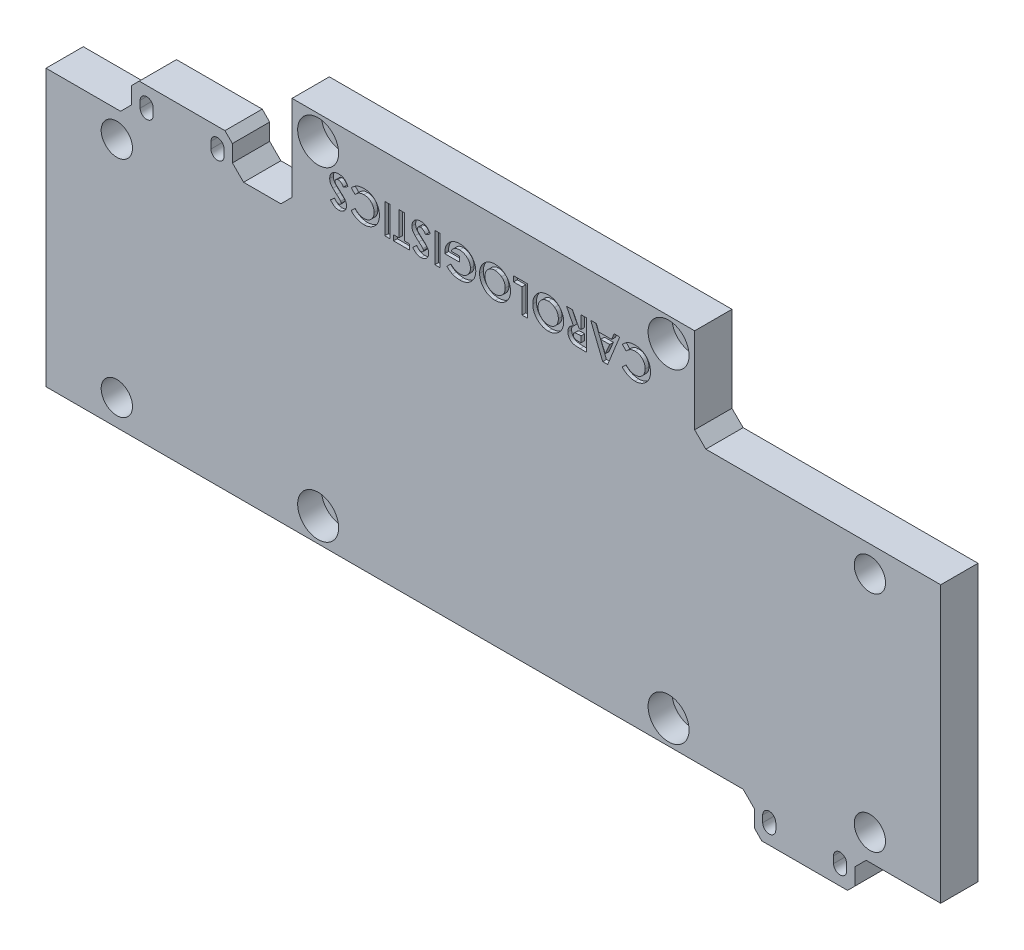
from build123d import *

# Parameters (mm, degrees)
SKIZZE1_W                                            = 240
SKIZZE1_H                                            = 100
AUFSATZ_LINEAR_AUSTRAGEN1_DEPTH                      = 10
STIRNSENKUNG_F_R_M6_ZYLINDERSCHRAUBE_MIT_D           = 6.6
STIRNSENKUNG_F_R_M6_ZYLINDERSCHRAUBE_MIT_DEPTH       = 15
STIRNSENKUNG_F_R_M6_ZYLINDERSCHRAUBE_MIT_CBORE_D     = 11
STIRNSENKUNG_F_R_M6_ZYLINDERSCHRAUBE_MIT_CBORE_DEPTH = 6.4
STIRNSENKUNG_F_R_M6_ZYLINDERSCHRAUBE_MIT_TIP         = 1.982840043
CBORE_FOR_M6_HEX_SOCKET_HEAD_CAP_SCREW1_D            = 6.6
CBORE_FOR_M6_HEX_SOCKET_HEAD_CAP_SCREW1_DEPTH        = 15
CBORE_FOR_M6_HEX_SOCKET_HEAD_CAP_SCREW1_CBORE_D      = 11
CBORE_FOR_M6_HEX_SOCKET_HEAD_CAP_SCREW1_CBORE_DEPTH  = 6.4
CBORE_FOR_M6_HEX_SOCKET_HEAD_CAP_SCREW1_TIP          = 1.982840043
M8_CLEARANCE_HOLE1_D                                 = 8.4
M8_CLEARANCE_HOLE1_DEPTH                             = 17
M8_CLEARANCE_HOLE1_TIP                               = 2.5236146
SKIZZE18_W                                           = 66
SKIZZE18_H                                           = 26
SCHNITT_LINEAR_AUSTRAGEN1_DEPTH                      = 15
SKETCH1_W                                            = 27
SKETCH1_H                                            = 10
BOSS_EXTRUDE1_DEPTH                                  = 9.5
CUT_EXTRUDE1_DEPTH                                   = 10
LPATTERN1_COUNT                                      = 2
LPATTERN1_PITCH                                      = 19
CUT_EXTRUDE2_START                                   = -10
CUT_EXTRUDE2_DEPTH                                   = 3
LPATTERN2_COUNT                                      = 2
LPATTERN2_PITCH                                      = 19
MIRROR1_COPY_1_DEPTH                                 = 10
MIRROR1_START                                        = -10
MIRROR1_COPY_2_DEPTH                                 = 3
SKETCH5_W                                            = 27
SKETCH5_H                                            = 9.5
CUT_EXTRUDE3_DEPTH                                   = 10
MIRROR2_COPY_1_DEPTH                                 = 10
MIRROR2_START                                        = -10
MIRROR2_COPY_2_DEPTH                                 = 3
CHAMFER1_SIZE                                        = 3
CHAMFER3_SIZE                                        = 2
CHAMFER4_SIZE                                        = 3
SKETCH8_W                                            = 1.435897436
SKETCH8_H                                            = 8
CUT_EXTRUDE4_DEPTH                                   = 1


with BuildPart() as part:
    # Skizze1 → Aufsatz-Linear austragen1 (new body)
    with BuildSketch(Plane.XY):
        Rectangle(SKIZZE1_W, SKIZZE1_H)
    extrude(amount=AUFSATZ_LINEAR_AUSTRAGEN1_DEPTH)

    # Stirnsenkung für M6 Zylinderschraube mit Innensechskant1
    with Locations(Plane.XY.offset(10)):
        with Locations((-47, -43.5), (47, -43.5)):
            CounterBoreHole(STIRNSENKUNG_F_R_M6_ZYLINDERSCHRAUBE_MIT_D / 2, STIRNSENKUNG_F_R_M6_ZYLINDERSCHRAUBE_MIT_CBORE_D / 2, STIRNSENKUNG_F_R_M6_ZYLINDERSCHRAUBE_MIT_CBORE_DEPTH, depth=STIRNSENKUNG_F_R_M6_ZYLINDERSCHRAUBE_MIT_DEPTH)
            with Locations((0, 0, -(STIRNSENKUNG_F_R_M6_ZYLINDERSCHRAUBE_MIT_DEPTH + STIRNSENKUNG_F_R_M6_ZYLINDERSCHRAUBE_MIT_TIP / 2))):  # 118° drill point
                Cone(0, STIRNSENKUNG_F_R_M6_ZYLINDERSCHRAUBE_MIT_D / 2, STIRNSENKUNG_F_R_M6_ZYLINDERSCHRAUBE_MIT_TIP, mode=Mode.SUBTRACT)

    # CBORE for M6 Hex Socket Head Cap Screw1
    with Locations(Plane.XY.offset(10)):
        with Locations((-47, 43.5), (47, 43.5)):
            CounterBoreHole(CBORE_FOR_M6_HEX_SOCKET_HEAD_CAP_SCREW1_D / 2, CBORE_FOR_M6_HEX_SOCKET_HEAD_CAP_SCREW1_CBORE_D / 2, CBORE_FOR_M6_HEX_SOCKET_HEAD_CAP_SCREW1_CBORE_DEPTH, depth=CBORE_FOR_M6_HEX_SOCKET_HEAD_CAP_SCREW1_DEPTH)
            with Locations((0, 0, -(CBORE_FOR_M6_HEX_SOCKET_HEAD_CAP_SCREW1_DEPTH + CBORE_FOR_M6_HEX_SOCKET_HEAD_CAP_SCREW1_TIP / 2))):  # 118° drill point
                Cone(0, CBORE_FOR_M6_HEX_SOCKET_HEAD_CAP_SCREW1_D / 2, CBORE_FOR_M6_HEX_SOCKET_HEAD_CAP_SCREW1_TIP, mode=Mode.SUBTRACT)

    # M8 Clearance Hole1
    with Locations(Plane.XY.offset(10)):
        with Locations((-101, 17), (-101, -43), (101, 17), (101, -43)):
            Hole(M8_CLEARANCE_HOLE1_D / 2, depth=M8_CLEARANCE_HOLE1_DEPTH)
            with Locations((0, 0, -(M8_CLEARANCE_HOLE1_DEPTH + M8_CLEARANCE_HOLE1_TIP / 2))):  # 118° drill point
                Cone(0, M8_CLEARANCE_HOLE1_D / 2, M8_CLEARANCE_HOLE1_TIP, mode=Mode.SUBTRACT)

    # Skizze18 → Schnitt-Linear austragen1 (cut)
    with BuildSketch(Plane.XY.offset(10)):
        with Locations((-87, 37)):
            Rectangle(SKIZZE18_W, SKIZZE18_H)
    schnitt_linear_austragen1 = extrude(amount=-SCHNITT_LINEAR_AUSTRAGEN1_DEPTH, mode=Mode.SUBTRACT)

    # Spiegeln1: Schnitt-Linear austragen1 across plane
    add(schnitt_linear_austragen1.mirror(Plane(origin=(0, 0, 0), x_dir=(0, 0, 1), z_dir=(1, 0, 0))), mode=Mode.SUBTRACT)

    # Sketch1 → Boss-Extrude1 (add)
    with BuildSketch(Plane(origin=(0, 24, 0), x_dir=(1, 0, 0), z_dir=(0, 1, 0))):
        with Locations((83.5, -5)):
            Rectangle(SKETCH1_W, SKETCH1_H)
    boss_extrude1 = extrude(amount=BOSS_EXTRUDE1_DEPTH)

    # Sketch3 → Cut-Extrude1 (cut)
    with BuildSketch(Plane(origin=(0, 0, 0), x_dir=(-1, 0, 0), z_dir=(0, 0, -1))):
        with BuildLine():
            Line((-91.25, 29.15), (-91.25, 27.35))
            ThreePointArc((-91.25, 27.35), (-93, 25.6), (-94.75, 27.35))
            Line((-94.75, 27.35), (-94.75, 29.15))
            ThreePointArc((-94.75, 29.15), (-93, 30.9), (-91.25, 29.15))
        make_face()
    cut_extrude1 = extrude(amount=-CUT_EXTRUDE1_DEPTH, mode=Mode.SUBTRACT)

    # LPattern1: Cut-Extrude1 ×2
    with Locations(*[(-i * LPATTERN1_PITCH, 0, 0) for i in range(1, LPATTERN1_COUNT)]):
        add(cut_extrude1, mode=Mode.SUBTRACT)

    # Sketch4 → Cut-Extrude2 (cut)
    with BuildSketch(Plane.XY.offset(10).offset(CUT_EXTRUDE2_START)):
        Polygon((74, 32.383161507), (71.2, 30.766580754), (71.2, 28.375279034), (71.2, 25.733419246), (74, 24.116838493), (76.8, 25.733419246), (76.8, 28.372780006), (76.8, 30.766580754), align=None)
    cut_extrude2 = extrude(amount=CUT_EXTRUDE2_DEPTH, mode=Mode.SUBTRACT)

    # LPattern2: Cut-Extrude2 ×2
    with Locations(*[(i * LPATTERN2_PITCH, 0, 0) for i in range(1, LPATTERN2_COUNT)]):
        add(cut_extrude2, mode=Mode.SUBTRACT)

    # Mirror1: Boss-Extrude1, Cut-Extrude1, Cut-Extrude2 across plane
    add(boss_extrude1.mirror(Plane.ZX.offset(-13)))
    add(cut_extrude1.mirror(Plane.ZX.offset(-13)), mode=Mode.SUBTRACT)
    add(cut_extrude2.mirror(Plane.ZX.offset(-13)), mode=Mode.SUBTRACT)

    # Mirror1 copy 1 sketch → Mirror1 copy 1 (cut)
    with BuildSketch(Plane(origin=(-19, -26, 0), x_dir=(-1, 0, 0), z_dir=(0, 0, -1))):
        with BuildLine():
            Line((-91.25, -29.15), (-91.25, -27.35))
            ThreePointArc((-91.25, -27.35), (-93, -25.6), (-94.75, -27.35))
            Line((-94.75, -27.35), (-94.75, -29.15))
            ThreePointArc((-94.75, -29.15), (-93, -30.9), (-91.25, -29.15))
        make_face()
    extrude(amount=-MIRROR1_COPY_1_DEPTH, mode=Mode.SUBTRACT)

    # Mirror1 copy 2 sketch → Mirror1 copy 2 (cut)
    with BuildSketch(Plane(origin=(19, -26, 10), x_dir=(1, 0, 0), z_dir=(0, 0, 1)).offset(MIRROR1_START)):
        Polygon((74, -32.383161507), (71.2, -30.766580754), (71.2, -28.375279034), (71.2, -25.733419246), (74, -24.116838493), (76.8, -25.733419246), (76.8, -28.372780006), (76.8, -30.766580754), align=None)
    extrude(amount=MIRROR1_COPY_2_DEPTH, mode=Mode.SUBTRACT)

    # Sketch5 → Cut-Extrude3 (cut)
    with BuildSketch(Plane.XY.offset(10)):
        with Locations((83.5, 28.75)):
            Rectangle(SKETCH5_W, SKETCH5_H)
    extrude(amount=-CUT_EXTRUDE3_DEPTH, mode=Mode.SUBTRACT)

    # Mirror2: Boss-Extrude1, Cut-Extrude1, Cut-Extrude2 across plane
    add(boss_extrude1.mirror(Plane(origin=(0, 0, 0), x_dir=(0, 0, 1), z_dir=(1, 0, 0))))
    add(cut_extrude1.mirror(Plane(origin=(0, 0, 0), x_dir=(0, 0, 1), z_dir=(1, 0, 0))), mode=Mode.SUBTRACT)
    add(cut_extrude2.mirror(Plane(origin=(0, 0, 0), x_dir=(0, 0, 1), z_dir=(1, 0, 0))), mode=Mode.SUBTRACT)

    # Mirror2 copy 1 sketch → Mirror2 copy 1 (cut)
    with BuildSketch(Plane(origin=(19, 0, 0), x_dir=(1, 0, 0), z_dir=(0, 0, -1))):
        with BuildLine():
            Line((-91.25, -29.15), (-91.25, -27.35))
            ThreePointArc((-91.25, -27.35), (-93, -25.6), (-94.75, -27.35))
            Line((-94.75, -27.35), (-94.75, -29.15))
            ThreePointArc((-94.75, -29.15), (-93, -30.9), (-91.25, -29.15))
        make_face()
    extrude(amount=-MIRROR2_COPY_1_DEPTH, mode=Mode.SUBTRACT)

    # Mirror2 copy 2 sketch → Mirror2 copy 2 (cut)
    with BuildSketch(Plane(origin=(-19, 0, 10), x_dir=(-1, 0, 0), z_dir=(0, 0, 1)).offset(MIRROR2_START)):
        Polygon((74, -32.383161507), (71.2, -30.766580754), (71.2, -28.375279034), (71.2, -25.733419246), (74, -24.116838493), (76.8, -25.733419246), (76.8, -28.372780006), (76.8, -30.766580754), align=None)
    extrude(amount=MIRROR2_COPY_2_DEPTH, mode=Mode.SUBTRACT)

    # Chamfer1
    chamfer1_edges = [part.edges().sort_by_distance(p)[0] for p in [
        (-70, 24, 5),
        (-97, 24, 5),
        (97, -50, 5),
        (70, -50, 5),
    ]]
    chamfer(chamfer1_edges, length=CHAMFER1_SIZE)

    # Chamfer3
    chamfer3_edges = [part.edges().sort_by_distance(p)[0] for p in [
        (-97, 33.5, 5),
        (-70, 33.5, 5),
        (70, -59.5, 5),
        (97, -59.5, 5),
    ]]
    chamfer(chamfer3_edges, length=CHAMFER3_SIZE)

    # Chamfer4
    chamfer4_edges = [part.edges().sort_by_distance(p)[0] for p in [
        (-54, 24, 5),
        (54, 24, 5),
    ]]
    chamfer(chamfer4_edges, length=CHAMFER4_SIZE)

    # Sketch8 → Cut-Extrude4 (cut)
    # profile 1 of 13: a face of its own
    with BuildSketch(Plane.XY.offset(10)):
        with BuildLine():
            Line((-43.692307692, 31.568910256), (-42.618589744, 32.551282051))
            add(Edge.make_bspline(
                [(-42.618589744, 32.551282051), (-42.572605121, 32.486391886), (-42.484321058, 32.361811817), (-42.341077959, 32.195178274), (-42.198690635, 32.052094928), (-42.054247834, 31.936652697), (-41.910236405, 31.843718064), (-41.763596751, 31.7796173), (-41.616015858, 31.738393715), (-41.516812206, 31.733285379), (-41.467948718, 31.730769231)],
                knots=[0, 0, 0, 0, 1.299459705, 2.494781419, 3.587730629, 4.594196874, 5.512431013, 6.380462003, 7.202284646, 8, 8, 8, 8], degree=3))
            add(Edge.make_bspline(
                [(-41.467948718, 31.730769231), (-41.422351589, 31.732320008), (-41.334315512, 31.735314152), (-41.209398131, 31.766573359), (-41.097138761, 31.817086557), (-41.000527688, 31.88686248), (-40.922806182, 31.970195179), (-40.862373068, 32.058906905), (-40.827255268, 32.155631897), (-40.822745449, 32.22196759), (-40.820512821, 32.254807692)],
                knots=[0, 0, 0, 0, 1.184157716, 2.286297433, 3.324836695, 4.370048774, 5.362957217, 6.276446515, 7.146738784, 8, 8, 8, 8], degree=3))
            add(Edge.make_bspline(
                [(-40.820512821, 32.254807692), (-40.821926071, 32.28810595), (-40.824772161, 32.355164012), (-40.852261519, 32.453445954), (-40.89369583, 32.549478853), (-40.933288005, 32.607938648), (-40.953525641, 32.637820513)],
                knots=[0, 0, 0, 0, 0.967525499, 1.948461899, 2.951351359, 4, 4, 4, 4], degree=3))
            add(Edge.make_bspline(
                [(-40.953525641, 32.637820513), (-40.971998034, 32.660978274), (-41.014764735, 32.714592392), (-41.09383378, 32.800864935), (-41.197221313, 32.902144102), (-41.320557563, 33.023533065), (-41.468471106, 33.160316642), (-41.637786171, 33.316455249), (-41.832269823, 33.486644971), (-41.968525472, 33.606791155), (-42.040064103, 33.669871795)],
                knots=[0, 0, 0, 0, 0.473849886, 1.097042329, 1.870584189, 2.789244661, 3.865562256, 5.093556389, 6.47402294, 8, 8, 8, 8], degree=3))
            add(Edge.make_bspline(
                [(-42.040064103, 33.669871795), (-42.1073743, 33.728095599), (-42.235115072, 33.838592282), (-42.416634474, 33.995682489), (-42.57719845, 34.136378406), (-42.715346732, 34.261733606), (-42.835207519, 34.366585802), (-42.931479644, 34.457385645), (-43.008283353, 34.530161036), (-43.05189886, 34.574167786), (-43.070512821, 34.592948718)],
                knots=[0, 0, 0, 0, 1.543627419, 2.929484142, 4.163674036, 5.24627963, 6.164986907, 6.925413438, 7.541394495, 8, 8, 8, 8], degree=3))
            add(Edge.make_bspline(
                [(-43.070512821, 34.592948718), (-43.141173849, 34.669359058), (-43.277009161, 34.816246566), (-43.453201125, 35.044492222), (-43.599775805, 35.265583992), (-43.713282888, 35.485765141), (-43.795603245, 35.709585924), (-43.855529547, 35.940239708), (-43.89144958, 36.181024385), (-43.895425109, 36.344964897), (-43.897435897, 36.427884615)],
                knots=[0, 0, 0, 0, 1.206413378, 2.319150186, 3.339784753, 4.27899982, 5.184598145, 6.099639703, 7.038813909, 8, 8, 8, 8], degree=3))
            add(Edge.make_bspline(
                [(-43.897435897, 36.427884615), (-43.896002909, 36.508680375), (-43.893191333, 36.667204664), (-43.858792209, 36.899192111), (-43.809670962, 37.121172988), (-43.733980911, 37.330923494), (-43.640951878, 37.530929344), (-43.527571921, 37.721257796), (-43.388953593, 37.89746544), (-43.234989034, 38.064306845), (-43.062026093, 38.214064396), (-42.876035237, 38.346095), (-42.676662269, 38.457571747), (-42.465426554, 38.549440075), (-42.239678856, 38.617616516), (-42.002985444, 38.669161877), (-41.752961539, 38.700241294), (-41.582353378, 38.703475764), (-41.495192308, 38.705128205)],
                knots=[0, 0, 0, 0, 1.043039441, 2.046482205, 3.024244422, 3.976033659, 4.920890471, 5.871402525, 6.830893638, 7.812473116, 8.800703348, 9.781190227, 10.754606487, 11.746997808, 12.751247331, 13.796362838, 14.874195872, 16, 16, 16, 16], degree=3))
            add(Edge.make_bspline(
                [(-41.495192308, 38.705128205), (-41.426770605, 38.703915682), (-41.291256394, 38.701514191), (-41.091538367, 38.681867741), (-40.898651894, 38.650260397), (-40.712982228, 38.60460865), (-40.533354896, 38.548084075), (-40.36171925, 38.474581929), (-40.19579329, 38.39146072), (-40.036128814, 38.295136699), (-39.884048879, 38.183265699), (-39.735171781, 38.060263197), (-39.594775362, 37.919383034), (-39.457495455, 37.765761046), (-39.329065548, 37.594944901), (-39.202718077, 37.412074613), (-39.084619698, 37.212778557), (-39.011636945, 37.072998907), (-38.974358974, 37.001602564)],
                knots=[0, 0, 0, 0, 1.017088714, 2.014418954, 2.980620591, 3.920647918, 4.854987948, 5.776890852, 6.693269322, 7.612671471, 8.545186947, 9.498010697, 10.480815007, 11.499174288, 12.558697099, 13.655746277, 14.802607237, 16, 16, 16, 16], degree=3))
            Line((-38.974358974, 37.001602564), (-40.237179487, 36.243589744))
            add(Edge.make_bspline(
                [(-40.237179487, 36.243589744), (-40.28380534, 36.324636632), (-40.373191085, 36.480010445), (-40.524663586, 36.688774854), (-40.679839431, 36.867547013), (-40.842306145, 37.013167114), (-41.010088195, 37.127582284), (-41.183996006, 37.209351302), (-41.364151764, 37.259966231), (-41.486865681, 37.266147483), (-41.548076923, 37.269230769)],
                knots=[0, 0, 0, 0, 1.283663364, 2.460892379, 3.537111102, 4.529833553, 5.449777664, 6.316464042, 7.160231139, 8, 8, 8, 8], degree=3))
            add(Edge.make_bspline(
                [(-41.548076923, 37.269230769), (-41.610348985, 37.266736718), (-41.731165855, 37.261897894), (-41.903900373, 37.216321083), (-42.062963993, 37.14636669), (-42.199718313, 37.044628781), (-42.315849019, 36.928617973), (-42.399102801, 36.797776049), (-42.45310662, 36.657907654), (-42.458716841, 36.560305992), (-42.461538462, 36.511217949)],
                knots=[0, 0, 0, 0, 1.13537643, 2.202795631, 3.242191317, 4.290390765, 5.297919085, 6.223733717, 7.106639842, 8, 8, 8, 8], degree=3))
            add(Edge.make_bspline(
                [(-42.461538462, 36.511217949), (-42.458897344, 36.465572433), (-42.453532168, 36.372847939), (-42.414229005, 36.234901488), (-42.352270582, 36.097623934), (-42.281166013, 35.983833463), (-42.207035671, 35.888984373), (-42.134373734, 35.808037659), (-42.048256772, 35.716734566), (-41.946490476, 35.617564832), (-41.831054185, 35.508621737), (-41.701569983, 35.390164305), (-41.556643447, 35.263158136), (-41.454204968, 35.176646323), (-41.400641026, 35.131410256)],
                knots=[0, 0, 0, 0, 0.916057066, 1.860882232, 2.859899639, 3.934694552, 4.546382938, 5.276161949, 6.118633209, 7.067046139, 8.129668089, 9.306861125, 10.591787583, 12, 12, 12, 12], degree=3))
            add(Edge.make_bspline(
                [(-41.400641026, 35.131410256), (-41.298817651, 35.045252262), (-41.103387776, 34.879888993), (-40.827171255, 34.635701008), (-40.578448717, 34.407315006), (-40.358878954, 34.192903875), (-40.167809734, 33.993837571), (-40.003137653, 33.8118637), (-39.867523727, 33.643413784), (-39.726900406, 33.442220303), (-39.589507299, 33.200510133), (-39.472742713, 32.90833872), (-39.397279698, 32.616533122), (-39.388792648, 32.420301645), (-39.384615385, 32.323717949)],
                knots=[0, 0, 0, 0, 1.345685333, 2.582777463, 3.719355561, 4.752181389, 5.678433858, 6.502864483, 7.227563063, 7.858499643, 8.978226409, 10.023061349, 11.026965269, 12, 12, 12, 12], degree=3))
            add(Edge.make_bspline(
                [(-39.384615385, 32.323717949), (-39.386353518, 32.255227588), (-39.389777827, 32.12029422), (-39.420232751, 31.921871098), (-39.465960473, 31.730499948), (-39.531674037, 31.546229193), (-39.619813924, 31.371134735), (-39.723923277, 31.202382632), (-39.846966576, 31.040488673), (-39.987987266, 30.889044141), (-40.142789168, 30.749828531), (-40.307900449, 30.627688876), (-40.481795622, 30.52440797), (-40.66500202, 30.440269435), (-40.857195458, 30.374612005), (-41.058553453, 30.328210837), (-41.268458944, 30.300539994), (-41.411240877, 30.296784734), (-41.483974359, 30.294871795)],
                knots=[0, 0, 0, 0, 1.010806554, 1.991397492, 2.957573065, 3.913225829, 4.872777376, 5.846906201, 6.837692339, 7.870332167, 8.898170327, 9.907899016, 10.8981826, 11.879407896, 12.8797257, 13.891947133, 14.926152479, 16, 16, 16, 16], degree=3))
            add(Edge.make_bspline(
                [(-41.483974359, 30.294871795), (-41.578227768, 30.298329175), (-41.765990583, 30.305216645), (-42.043685486, 30.358793505), (-42.315059803, 30.443937665), (-42.534415514, 30.54423366), (-42.707451186, 30.644487857), (-42.840389245, 30.734916546), (-42.976715801, 30.838759708), (-43.113928134, 30.959039257), (-43.257229372, 31.088802282), (-43.399381267, 31.23695395), (-43.547344811, 31.395903393), (-43.643140224, 31.510231032), (-43.692307692, 31.568910256)],
                knots=[0, 0, 0, 0, 1.282890948, 2.555655204, 3.837225328, 5.149160694, 5.83044799, 6.558852598, 7.337307105, 8.162686284, 9.043076448, 9.969084596, 10.957622644, 12, 12, 12, 12], degree=3))
        make_face()
    # profile 2 of 13: a face of its own
    with BuildSketch(Plane.XY.offset(10)):
        with BuildLine():
            Line((-38.153846154, 31.887820513), (-37.100961538, 32.894230769))
            add(Edge.make_bspline(
                [(-37.100961538, 32.894230769), (-37.011751247, 32.801745077), (-36.837211934, 32.620797467), (-36.554626072, 32.383917342), (-36.264116209, 32.182598967), (-35.964869214, 32.018510179), (-35.657056991, 31.888287999), (-35.340144003, 31.797445062), (-35.014895762, 31.74024497), (-34.795107561, 31.733945363), (-34.684294872, 31.730769231)],
                knots=[0, 0, 0, 0, 1.115370381, 2.182214363, 3.196266025, 4.180416361, 5.141116029, 6.092551847, 7.038303877, 8, 8, 8, 8], degree=3))
            add(Edge.make_bspline(
                [(-34.684294872, 31.730769231), (-34.591765108, 31.733327683), (-34.409167815, 31.738376508), (-34.141092473, 31.775478563), (-33.884567328, 31.838334239), (-33.639388859, 31.925703172), (-33.404344878, 32.035729955), (-33.181624061, 32.174025688), (-32.970029484, 32.335974584), (-32.772033453, 32.521293253), (-32.593285866, 32.72526574), (-32.432231751, 32.940085334), (-32.298831746, 33.169551672), (-32.189937473, 33.410318432), (-32.104126283, 33.662472556), (-32.043222637, 33.926001422), (-32.007935024, 34.201500032), (-32.002673872, 34.388788732), (-32, 34.483974359)],
                knots=[0, 0, 0, 0, 1.035268443, 2.04298821, 3.02163646, 3.985902049, 4.951223231, 5.920091634, 6.913651787, 7.92868536, 8.949353712, 9.945284791, 10.92850487, 11.913014323, 12.897904816, 13.904240668, 14.934873455, 16, 16, 16, 16], degree=3))
            add(Edge.make_bspline(
                [(-32, 34.483974359), (-32.00078158, 34.550780332), (-32.00232209, 34.682456277), (-32.01876024, 34.876741091), (-32.046060031, 35.065650917), (-32.084350147, 35.248626038), (-32.132554145, 35.426455768), (-32.191551249, 35.597981809), (-32.262884416, 35.763424231), (-32.342718078, 35.923649669), (-32.431829499, 36.07730046), (-32.531719314, 36.222339036), (-32.641268186, 36.357638388), (-32.756092672, 36.487906461), (-32.883797343, 36.605519772), (-33.018664414, 36.716960157), (-33.162628967, 36.819466841), (-33.315516171, 36.911613302), (-33.472762517, 36.997492204), (-33.637590228, 37.068610998), (-33.805393369, 37.132542559), (-33.979115773, 37.180638328), (-34.155697329, 37.22247148), (-34.337595887, 37.248020288), (-34.523085162, 37.267434003), (-34.648450297, 37.268629269), (-34.711538462, 37.269230769)],
                knots=[0, 0, 0, 0, 1.103833241, 2.175677997, 3.219414644, 4.256521947, 5.263082927, 6.262573145, 7.25136242, 8.238376666, 9.219530388, 10.184343756, 11.145312504, 12.095474572, 13.051075647, 14.010745898, 14.985684176, 15.968306307, 16.959653902, 17.943861036, 18.93268972, 19.924626761, 20.920484516, 21.929288403, 22.957944781, 24, 24, 24, 24], degree=3))
            add(Edge.make_bspline(
                [(-34.711538462, 37.269230769), (-34.818548697, 37.266142538), (-35.028795984, 37.260074966), (-35.33731864, 37.212420272), (-35.632156384, 37.134383783), (-35.867268317, 37.040521186), (-36.051232232, 36.949273334), (-36.191209319, 36.866079872), (-36.335345138, 36.771845125), (-36.482652838, 36.663958642), (-36.633929808, 36.543704323), (-36.786577235, 36.408568702), (-36.944481947, 36.262966943), (-37.047924584, 36.159049584), (-37.100961538, 36.105769231)],
                knots=[0, 0, 0, 0, 1.404640003, 2.759752344, 4.088613405, 5.401587939, 6.076032573, 6.783413463, 7.538272532, 8.336594406, 9.180107851, 10.074881764, 11.012956238, 12, 12, 12, 12], degree=3))
            Line((-37.100961538, 36.105769231), (-38.121794872, 37.177884615))
            add(Edge.make_bspline(
                [(-38.121794872, 37.177884615), (-38.050035784, 37.247165765), (-37.909977391, 37.382387754), (-37.698703178, 37.574390314), (-37.487694918, 37.746926128), (-37.282049881, 37.906256701), (-37.078400262, 38.04774306), (-36.876764627, 38.171517046), (-36.679436127, 38.280742219), (-36.482280087, 38.373461505), (-36.283731468, 38.45269227), (-36.079531904, 38.519511581), (-35.869583826, 38.57784026), (-35.652148438, 38.623741922), (-35.428195913, 38.661109052), (-35.197006613, 38.685800429), (-34.959660731, 38.702922346), (-34.799176951, 38.704386918), (-34.717948718, 38.705128205)],
                knots=[0, 0, 0, 0, 1.244537013, 2.429070097, 3.56066612, 4.644477994, 5.67429546, 6.652817684, 7.595405349, 8.486886006, 9.369351459, 10.26090686, 11.166404474, 12.086719576, 13.0323422, 13.998023148, 14.9867073, 16, 16, 16, 16], degree=3))
            add(Edge.make_bspline(
                [(-34.717948718, 38.705128205), (-34.568748266, 38.701318066), (-34.276804455, 38.693862684), (-33.848927164, 38.638813508), (-33.442118002, 38.54591522), (-33.055645995, 38.416316299), (-32.690693908, 38.248032792), (-32.346117246, 38.04384009), (-32.022489835, 37.801800187), (-31.722596457, 37.525519253), (-31.451413622, 37.220325962), (-31.211448436, 36.892757665), (-31.013822268, 36.54046201), (-30.846146622, 36.170985398), (-30.720499196, 35.778551482), (-30.629038944, 35.366706355), (-30.573385858, 34.933682649), (-30.567238008, 34.637986461), (-30.564102564, 34.487179487)],
                knots=[0, 0, 0, 0, 1.07798487, 2.109316747, 3.111276023, 4.08905949, 5.049398091, 6.009992678, 6.978127636, 7.964347882, 8.951383687, 9.924270623, 10.892397886, 11.86520058, 12.851549246, 13.863953586, 14.910602472, 16, 16, 16, 16], degree=3))
            add(Edge.make_bspline(
                [(-30.564102564, 34.487179487), (-30.565471958, 34.38882865), (-30.568185761, 34.193921327), (-30.594939344, 33.906062494), (-30.635980507, 33.626616271), (-30.694391719, 33.355926354), (-30.767018309, 33.093055493), (-30.859461455, 32.839193885), (-30.966534357, 32.592951802), (-31.091540812, 32.356624013), (-31.231666377, 32.129911873), (-31.384861512, 31.913388437), (-31.55407626, 31.709207361), (-31.737702606, 31.516475619), (-31.93421444, 31.333947526), (-32.145533635, 31.162918499), (-32.371862253, 31.004491462), (-32.610891665, 30.858536212), (-32.858071276, 30.724496463), (-33.113576754, 30.612104467), (-33.372428792, 30.512889589), (-33.636381255, 30.432751567), (-33.906015108, 30.372303257), (-34.179271369, 30.326687019), (-34.458382724, 30.301156618), (-34.645785135, 30.296980082), (-34.740384615, 30.294871795)],
                knots=[0, 0, 0, 0, 1.07193642, 2.124315995, 3.14887099, 4.149444713, 5.141371803, 6.119544533, 7.092241254, 8.06650569, 9.031360777, 9.996057679, 10.955696533, 11.919602115, 12.89624813, 13.877605408, 14.880920851, 15.905674436, 16.929600311, 17.943674756, 18.946313929, 19.950355855, 20.947755382, 21.956851243, 22.968632213, 24, 24, 24, 24], degree=3))
            add(Edge.make_bspline(
                [(-34.740384615, 30.294871795), (-34.82108706, 30.296081836), (-34.981652869, 30.298489337), (-35.220768893, 30.318523009), (-35.457946403, 30.350075019), (-35.692461133, 30.397347624), (-35.925367684, 30.454596925), (-36.155690937, 30.525112609), (-36.382795769, 30.611125217), (-36.608650999, 30.706273312), (-36.828752282, 30.814594479), (-37.041186787, 30.935838799), (-37.246480891, 31.066834406), (-37.44339701, 31.209834445), (-37.633322109, 31.362738431), (-37.816053542, 31.525541303), (-37.989837862, 31.701196263), (-38.098900347, 31.825297942), (-38.153846154, 31.887820513)],
                knots=[0, 0, 0, 0, 0.996333415, 1.982307736, 2.96084097, 3.949129141, 4.93457382, 5.921430247, 6.92116383, 7.931890485, 8.946633814, 9.948019707, 10.950686436, 11.952094051, 12.951305284, 13.960287133, 14.972390273, 16, 16, 16, 16], degree=3))
        make_face()
    # profile 3 of 13: a face of its own
    with BuildSketch(Plane.XY.offset(10)):
        with Locations((-28.41025641, 34.5)):
            Rectangle(SKETCH8_W, SKETCH8_H)
    # profile 4 of 13: a face of its own
    with BuildSketch(Plane.XY.offset(10)):
        Polygon((-22.461538462, 30.5), (-26.769230769, 30.5), (-26.769230769, 31.935897436), (-25.333333333, 31.935897436), (-25.333333333, 38.5), (-23.897435897, 38.5), (-23.897435897, 31.935897436), (-22.461538462, 31.935897436), align=None)
    # profile 5 of 13: a face of its own
    with BuildSketch(Plane.XY.offset(10)):
        with BuildLine():
            Line((-21.641025641, 31.568910256), (-20.567307692, 32.551282051))
            add(Edge.make_bspline(
                [(-20.567307692, 32.551282051), (-20.52132307, 32.486391886), (-20.433039007, 32.361811817), (-20.289795907, 32.195178274), (-20.147408584, 32.052094928), (-20.002965782, 31.936652697), (-19.858954354, 31.843718064), (-19.7123147, 31.7796173), (-19.564733807, 31.738393715), (-19.465530155, 31.733285379), (-19.416666667, 31.730769231)],
                knots=[0, 0, 0, 0, 1.299459705, 2.494781419, 3.587730629, 4.594196874, 5.512431013, 6.380462003, 7.202284646, 8, 8, 8, 8], degree=3))
            add(Edge.make_bspline(
                [(-19.416666667, 31.730769231), (-19.371069537, 31.732320008), (-19.28303346, 31.735314152), (-19.15811608, 31.766573359), (-19.04585671, 31.817086557), (-18.949245637, 31.88686248), (-18.87152413, 31.970195179), (-18.811091017, 32.058906905), (-18.775973217, 32.155631897), (-18.771463397, 32.22196759), (-18.769230769, 32.254807692)],
                knots=[0, 0, 0, 0, 1.184157716, 2.286297433, 3.324836695, 4.370048774, 5.362957217, 6.276446515, 7.146738784, 8, 8, 8, 8], degree=3))
            add(Edge.make_bspline(
                [(-18.769230769, 32.254807692), (-18.77064402, 32.28810595), (-18.77349011, 32.355164012), (-18.800979467, 32.453445954), (-18.842413778, 32.549478853), (-18.882005954, 32.607938648), (-18.90224359, 32.637820513)],
                knots=[0, 0, 0, 0, 0.967525499, 1.948461899, 2.951351359, 4, 4, 4, 4], degree=3))
            add(Edge.make_bspline(
                [(-18.90224359, 32.637820513), (-18.920715982, 32.660978274), (-18.963482684, 32.714592392), (-19.042551729, 32.800864935), (-19.145939261, 32.902144102), (-19.269275512, 33.023533065), (-19.417189055, 33.160316642), (-19.586504119, 33.316455249), (-19.780987771, 33.486644971), (-19.917243421, 33.606791155), (-19.988782051, 33.669871795)],
                knots=[0, 0, 0, 0, 0.473849886, 1.097042329, 1.870584189, 2.789244661, 3.865562256, 5.093556389, 6.47402294, 8, 8, 8, 8], degree=3))
            add(Edge.make_bspline(
                [(-19.988782051, 33.669871795), (-20.056092249, 33.728095599), (-20.183833021, 33.838592282), (-20.365352423, 33.995682489), (-20.525916398, 34.136378406), (-20.664064681, 34.261733606), (-20.783925468, 34.366585802), (-20.880197593, 34.457385645), (-20.957001302, 34.530161036), (-21.000616809, 34.574167786), (-21.019230769, 34.592948718)],
                knots=[0, 0, 0, 0, 1.543627419, 2.929484142, 4.163674036, 5.24627963, 6.164986907, 6.925413438, 7.541394495, 8, 8, 8, 8], degree=3))
            add(Edge.make_bspline(
                [(-21.019230769, 34.592948718), (-21.089891798, 34.669359058), (-21.22572711, 34.816246566), (-21.401919074, 35.044492222), (-21.548493754, 35.265583992), (-21.662000837, 35.485765141), (-21.744321194, 35.709585924), (-21.804247496, 35.940239708), (-21.840167529, 36.181024385), (-21.844143057, 36.344964897), (-21.846153846, 36.427884615)],
                knots=[0, 0, 0, 0, 1.206413378, 2.319150186, 3.339784753, 4.27899982, 5.184598145, 6.099639703, 7.038813909, 8, 8, 8, 8], degree=3))
            add(Edge.make_bspline(
                [(-21.846153846, 36.427884615), (-21.844720858, 36.508680375), (-21.841909282, 36.667204664), (-21.807510158, 36.899192111), (-21.758388911, 37.121172988), (-21.68269886, 37.330923494), (-21.589669827, 37.530929344), (-21.47628987, 37.721257796), (-21.337671541, 37.89746544), (-21.183706983, 38.064306845), (-21.010744042, 38.214064396), (-20.824753186, 38.346095), (-20.625380218, 38.457571747), (-20.414144502, 38.549440075), (-20.188396805, 38.617616516), (-19.951703393, 38.669161877), (-19.701679488, 38.700241294), (-19.531071326, 38.703475764), (-19.443910256, 38.705128205)],
                knots=[0, 0, 0, 0, 1.043039441, 2.046482205, 3.024244422, 3.976033659, 4.920890471, 5.871402525, 6.830893638, 7.812473116, 8.800703348, 9.781190227, 10.754606487, 11.746997808, 12.751247331, 13.796362838, 14.874195872, 16, 16, 16, 16], degree=3))
            add(Edge.make_bspline(
                [(-19.443910256, 38.705128205), (-19.375488554, 38.703915682), (-19.239974342, 38.701514191), (-19.040256316, 38.681867741), (-18.847369843, 38.650260397), (-18.661700176, 38.60460865), (-18.482072845, 38.548084075), (-18.310437199, 38.474581929), (-18.144511239, 38.39146072), (-17.984846762, 38.295136699), (-17.832766828, 38.183265699), (-17.68388973, 38.060263197), (-17.54349331, 37.919383034), (-17.406213404, 37.765761046), (-17.277783497, 37.594944901), (-17.151436025, 37.412074613), (-17.033337647, 37.212778557), (-16.960354893, 37.072998907), (-16.923076923, 37.001602564)],
                knots=[0, 0, 0, 0, 1.017088714, 2.014418954, 2.980620591, 3.920647918, 4.854987948, 5.776890852, 6.693269322, 7.612671471, 8.545186947, 9.498010697, 10.480815007, 11.499174288, 12.558697099, 13.655746277, 14.802607237, 16, 16, 16, 16], degree=3))
            Line((-16.923076923, 37.001602564), (-18.185897436, 36.243589744))
            add(Edge.make_bspline(
                [(-18.185897436, 36.243589744), (-18.232523289, 36.324636632), (-18.321909034, 36.480010445), (-18.473381535, 36.688774854), (-18.628557379, 36.867547013), (-18.791024094, 37.013167114), (-18.958806143, 37.127582284), (-19.132713955, 37.209351302), (-19.312869712, 37.259966231), (-19.43558363, 37.266147483), (-19.496794872, 37.269230769)],
                knots=[0, 0, 0, 0, 1.283663364, 2.460892379, 3.537111102, 4.529833553, 5.449777664, 6.316464042, 7.160231139, 8, 8, 8, 8], degree=3))
            add(Edge.make_bspline(
                [(-19.496794872, 37.269230769), (-19.559066934, 37.266736718), (-19.679883804, 37.261897894), (-19.852618322, 37.216321083), (-20.011681942, 37.14636669), (-20.148436261, 37.044628781), (-20.264566968, 36.928617973), (-20.347820749, 36.797776049), (-20.401824568, 36.657907654), (-20.40743479, 36.560305992), (-20.41025641, 36.511217949)],
                knots=[0, 0, 0, 0, 1.13537643, 2.202795631, 3.242191317, 4.290390765, 5.297919085, 6.223733717, 7.106639842, 8, 8, 8, 8], degree=3))
            add(Edge.make_bspline(
                [(-20.41025641, 36.511217949), (-20.407615293, 36.465572433), (-20.402250117, 36.372847939), (-20.362946954, 36.234901488), (-20.30098853, 36.097623934), (-20.229883962, 35.983833463), (-20.155753619, 35.888984373), (-20.083091683, 35.808037659), (-19.996974721, 35.716734566), (-19.895208425, 35.617564832), (-19.779772133, 35.508621737), (-19.650287931, 35.390164305), (-19.505361395, 35.263158136), (-19.402922917, 35.176646323), (-19.349358974, 35.131410256)],
                knots=[0, 0, 0, 0, 0.916057066, 1.860882232, 2.859899639, 3.934694552, 4.546382938, 5.276161949, 6.118633209, 7.067046139, 8.129668089, 9.306861125, 10.591787583, 12, 12, 12, 12], degree=3))
            add(Edge.make_bspline(
                [(-19.349358974, 35.131410256), (-19.2475356, 35.045252262), (-19.052105725, 34.879888993), (-18.775889204, 34.635701008), (-18.527166666, 34.407315006), (-18.307596903, 34.192903875), (-18.116527682, 33.993837571), (-17.951855602, 33.8118637), (-17.816241676, 33.643413784), (-17.675618355, 33.442220303), (-17.538225248, 33.200510133), (-17.421460662, 32.90833872), (-17.345997646, 32.616533122), (-17.337510597, 32.420301645), (-17.333333333, 32.323717949)],
                knots=[0, 0, 0, 0, 1.345685333, 2.582777463, 3.719355561, 4.752181389, 5.678433858, 6.502864483, 7.227563063, 7.858499643, 8.978226409, 10.023061349, 11.026965269, 12, 12, 12, 12], degree=3))
            add(Edge.make_bspline(
                [(-17.333333333, 32.323717949), (-17.335071467, 32.255227588), (-17.338495776, 32.12029422), (-17.368950699, 31.921871098), (-17.414678421, 31.730499948), (-17.480391985, 31.546229193), (-17.568531872, 31.371134735), (-17.672641226, 31.202382632), (-17.795684525, 31.040488673), (-17.936705215, 30.889044141), (-18.091507117, 30.749828531), (-18.256618397, 30.627688876), (-18.430513571, 30.52440797), (-18.613719969, 30.440269435), (-18.805913406, 30.374612005), (-19.007271402, 30.328210837), (-19.217176892, 30.300539994), (-19.359958826, 30.296784734), (-19.432692308, 30.294871795)],
                knots=[0, 0, 0, 0, 1.010806554, 1.991397492, 2.957573065, 3.913225829, 4.872777376, 5.846906201, 6.837692339, 7.870332167, 8.898170327, 9.907899016, 10.8981826, 11.879407896, 12.8797257, 13.891947133, 14.926152479, 16, 16, 16, 16], degree=3))
            add(Edge.make_bspline(
                [(-19.432692308, 30.294871795), (-19.526945717, 30.298329175), (-19.714708532, 30.305216645), (-19.992403434, 30.358793505), (-20.263777752, 30.443937665), (-20.483133463, 30.54423366), (-20.656169135, 30.644487857), (-20.789107193, 30.734916546), (-20.925433749, 30.838759708), (-21.062646083, 30.959039257), (-21.20594732, 31.088802282), (-21.348099216, 31.23695395), (-21.496062759, 31.395903393), (-21.591858172, 31.510231032), (-21.641025641, 31.568910256)],
                knots=[0, 0, 0, 0, 1.282890948, 2.555655204, 3.837225328, 5.149160694, 5.83044799, 6.558852598, 7.337307105, 8.162686284, 9.043076448, 9.969084596, 10.957622644, 12, 12, 12, 12], degree=3))
        make_face()
    # profile 6 of 13: a face of its own
    with BuildSketch(Plane.XY.offset(10)):
        with Locations((-14.974358974, 34.5)):
            Rectangle(SKETCH8_W, SKETCH8_H)
    # profile 7 of 13: a face of its own
    with BuildSketch(Plane.XY.offset(10)):
        with BuildLine():
            Line((-12.459935897, 31.772435897), (-11.373397436, 32.8125))
            add(Edge.make_bspline(
                [(-11.373397436, 32.8125), (-11.28737429, 32.726373783), (-11.118582676, 32.557379927), (-10.842545106, 32.337422809), (-10.556653958, 32.150415775), (-10.25996825, 31.996645511), (-9.952074698, 31.877367925), (-9.633580906, 31.792044851), (-9.303968726, 31.74143829), (-9.080835994, 31.734353544), (-8.967948718, 31.730769231)],
                knots=[0, 0, 0, 0, 1.075575784, 2.110457258, 3.113929901, 4.09197124, 5.059417775, 6.02750972, 7.002078037, 8, 8, 8, 8], degree=3))
            add(Edge.make_bspline(
                [(-8.967948718, 31.730769231), (-8.870079006, 31.733280884), (-8.677903246, 31.738212735), (-8.39551769, 31.775660776), (-8.125687848, 31.838226703), (-7.867106762, 31.924864566), (-7.621471314, 32.037741118), (-7.387289525, 32.174304873), (-7.167234618, 32.337971078), (-6.960376804, 32.522146522), (-6.772407056, 32.724734081), (-6.606143164, 32.93975932), (-6.465813109, 33.166907631), (-6.351739245, 33.404996953), (-6.262887334, 33.653107165), (-6.200728687, 33.912099015), (-6.16089634, 34.181456868), (-6.15621653, 34.365243412), (-6.153846154, 34.458333333)],
                knots=[0, 0, 0, 0, 1.07509559, 2.111044432, 3.123295838, 4.114414616, 5.101929537, 6.088414859, 7.087392227, 8.109987248, 9.127465927, 10.119435877, 11.091852952, 12.055283684, 13.015060431, 13.981632522, 14.977674508, 16, 16, 16, 16], degree=3))
            add(Edge.make_bspline(
                [(-6.153846154, 34.458333333), (-6.156078601, 34.554636762), (-6.160476828, 34.7443677), (-6.202208587, 35.022909628), (-6.267627111, 35.290309738), (-6.359204607, 35.54687985), (-6.478587383, 35.791890043), (-6.625573299, 36.02492852), (-6.797992634, 36.247021586), (-6.994335756, 36.455132097), (-7.208036472, 36.646821407), (-7.439289537, 36.812564852), (-7.681626886, 36.954038343), (-7.936581129, 37.071333635), (-8.205019268, 37.157866158), (-8.484632016, 37.223109732), (-8.77667905, 37.262047302), (-8.975845463, 37.266812444), (-9.076923077, 37.269230769)],
                knots=[0, 0, 0, 0, 1.021985222, 2.013450793, 2.98331293, 3.941376853, 4.900279932, 5.871285843, 6.861761207, 7.88100394, 8.905520213, 9.905129641, 10.896449179, 11.881305449, 12.878594847, 13.885755381, 14.927013861, 16, 16, 16, 16], degree=3))
            add(Edge.make_bspline(
                [(-9.076923077, 37.269230769), (-9.142675336, 37.268636915), (-9.271761652, 37.267471048), (-9.46111334, 37.248572452), (-9.642451398, 37.22151342), (-9.816549031, 37.185834748), (-9.981873499, 37.134669549), (-10.140668484, 37.076770199), (-10.290848199, 37.005035407), (-10.433721469, 36.923629038), (-10.569417833, 36.82987153), (-10.697498923, 36.724184539), (-10.818395886, 36.605605908), (-10.934191781, 36.476408747), (-11.040955144, 36.332819509), (-11.14246244, 36.178397614), (-11.237381353, 36.011432203), (-11.293472372, 35.893536868), (-11.322115385, 35.833333333)],
                knots=[0, 0, 0, 0, 1.109467577, 2.178131716, 3.208562196, 4.204278576, 5.174223432, 6.127254264, 7.054993225, 7.9799672, 8.900446918, 9.835649638, 10.779420865, 11.756673556, 12.761211291, 13.796640546, 14.874849225, 16, 16, 16, 16], degree=3))
            Line((-11.322115385, 35.833333333), (-9.025641026, 35.833333333))
            Line((-9.025641026, 35.833333333), (-9.025641026, 34.397435897))
            Line((-9.025641026, 34.397435897), (-13.014423077, 34.397435897))
            Line((-13.014423077, 34.397435897), (-13.025641026, 34.738782051))
            add(Edge.make_bspline(
                [(-13.025641026, 34.738782051), (-13.024199603, 34.826448404), (-13.021319329, 35.001624663), (-12.994996651, 35.262432269), (-12.951393531, 35.519780801), (-12.891783907, 35.773411798), (-12.817077919, 36.024569353), (-12.721804584, 36.270848646), (-12.610239404, 36.513919015), (-12.485241124, 36.752750809), (-12.344769373, 36.981907024), (-12.193565638, 37.198921713), (-12.033627688, 37.403260095), (-11.862303547, 37.592379272), (-11.679966455, 37.766070722), (-11.488818377, 37.926523117), (-11.288792842, 38.075137079), (-11.076346837, 38.206148351), (-10.85505095, 38.322954268), (-10.624917382, 38.426801156), (-10.38459899, 38.512585258), (-10.135173112, 38.583486198), (-9.876522153, 38.638025086), (-9.608751532, 38.675464776), (-9.33168354, 38.700893858), (-9.143755344, 38.703699693), (-9.048076923, 38.705128205)],
                knots=[0, 0, 0, 0, 1.006947556, 2.012098127, 3.007912615, 4.003802745, 5.003693661, 6.015789779, 7.034654729, 8.075083123, 9.110776623, 10.12033905, 11.112364132, 12.089932562, 13.049221985, 14.003156825, 14.955669239, 15.909347409, 16.867458246, 17.828943829, 18.807340259, 19.796171017, 20.806031855, 21.841452577, 22.901035528, 24, 24, 24, 24], degree=3))
            add(Edge.make_bspline(
                [(-9.048076923, 38.705128205), (-8.94600066, 38.703687276), (-8.743655061, 38.700830924), (-8.444878002, 38.675133689), (-8.154783263, 38.6303599), (-7.872363423, 38.574958137), (-7.59908116, 38.495888498), (-7.333151339, 38.404814795), (-7.077162573, 38.292120501), (-6.829007789, 38.166905985), (-6.591880581, 38.02344721), (-6.365632452, 37.867207294), (-6.15335712, 37.69477551), (-5.954163874, 37.507920786), (-5.766637816, 37.308265864), (-5.592613464, 37.093126248), (-5.430527589, 36.864578549), (-5.284342521, 36.621105933), (-5.151596492, 36.369347601), (-5.035901968, 36.110814764), (-4.93829042, 35.847883423), (-4.857034198, 35.579943328), (-4.795366923, 35.306690056), (-4.749693632, 35.028514551), (-4.724293695, 34.745666781), (-4.720073099, 34.55560235), (-4.717948718, 34.459935897)],
                knots=[0, 0, 0, 0, 1.084248544, 2.149304005, 3.182186427, 4.201621716, 5.204046643, 6.201899409, 7.185482703, 8.172726097, 9.152750634, 10.127173101, 11.09142983, 12.055001688, 13.026594436, 13.998833283, 14.992319766, 16.000574469, 17.013370274, 18.014203756, 19.007155264, 19.990967713, 20.986267719, 21.980774716, 22.98364929, 24, 24, 24, 24], degree=3))
            add(Edge.make_bspline(
                [(-4.717948718, 34.459935897), (-4.720777578, 34.329421543), (-4.726363737, 34.071694387), (-4.778297537, 33.692097439), (-4.858687608, 33.325228772), (-4.975779326, 32.972103713), (-5.123392348, 32.631298652), (-5.303522901, 32.303113467), (-5.517664068, 31.987969571), (-5.683500883, 31.792878144), (-5.767628205, 31.693910256)],
                knots=[0, 0, 0, 0, 1.034063014, 2.041967874, 3.031271063, 4.007437694, 4.986016733, 5.971461028, 6.970942901, 8, 8, 8, 8], degree=3))
            add(Edge.make_bspline(
                [(-5.767628205, 31.693910256), (-5.819858399, 31.636652929), (-5.923534547, 31.522997996), (-6.089260682, 31.365072153), (-6.259189678, 31.216616019), (-6.435675079, 31.080777511), (-6.617789133, 30.954583061), (-6.806055998, 30.840398283), (-6.999488069, 30.734587474), (-7.199593881, 30.642553735), (-7.405325853, 30.56003781), (-7.617595139, 30.490217736), (-7.834811887, 30.428373745), (-8.058899558, 30.38132633), (-8.287594331, 30.342148833), (-8.522519559, 30.315890023), (-8.763035056, 30.296644184), (-8.925707641, 30.295467264), (-9.008012821, 30.294871795)],
                knots=[0, 0, 0, 0, 1.020590567, 2.025856924, 3.013483481, 3.991664875, 4.957826714, 5.930500614, 6.890802512, 7.860442893, 8.829981142, 9.809047939, 10.802672283, 11.803273349, 12.823572789, 13.857849586, 14.916166035, 16, 16, 16, 16], degree=3))
            add(Edge.make_bspline(
                [(-9.008012821, 30.294871795), (-9.094048454, 30.296198612), (-9.265227774, 30.298838492), (-9.519743075, 30.317104735), (-9.770721715, 30.345285244), (-10.017106046, 30.387557616), (-10.259722934, 30.439688249), (-10.497316537, 30.506480493), (-10.731436859, 30.582368512), (-10.883848302, 30.642872048), (-10.959935897, 30.673076923)],
                knots=[0, 0, 0, 0, 1.03180557, 2.052914215, 3.058998889, 4.059601663, 5.049854447, 6.033765722, 7.018406786, 8, 8, 8, 8], degree=3))
            add(Edge.make_bspline(
                [(-10.959935897, 30.673076923), (-11.023960851, 30.700982315), (-11.154185835, 30.75774111), (-11.343522488, 30.861766255), (-11.534103209, 30.976501663), (-11.720761571, 31.109452722), (-11.908902454, 31.253074085), (-12.094686937, 31.412350348), (-12.27950904, 31.585815671), (-12.399014726, 31.709423534), (-12.459935897, 31.772435897)],
                knots=[0, 0, 0, 0, 0.894422958, 1.819231551, 2.765348375, 3.743239639, 4.753552307, 5.797344382, 6.877138289, 8, 8, 8, 8], degree=3))
        make_face()
    # profile 8 of 13: a face of its own
    with BuildSketch(Plane.XY.offset(10)):
        with BuildLine():
            add(Edge.make_bspline(
                [(0.445512821, 30.294871795), (0.306422322, 30.298471632), (0.031826174, 30.305578526), (-0.371993647, 30.364864704), (-0.761195381, 30.46135185), (-1.135834819, 30.596032368), (-1.494634255, 30.770455717), (-1.838912011, 30.982239583), (-2.167724629, 31.233181037), (-2.477238484, 31.519699135), (-2.761055111, 31.832997711), (-3.010533151, 32.167019128), (-3.222308384, 32.518314755), (-3.394206853, 32.886953039), (-3.52844716, 33.272427613), (-3.621742594, 33.674884771), (-3.681897278, 34.093809144), (-3.688799685, 34.379063661), (-3.692307692, 34.524038462)],
                knots=[0, 0, 0, 0, 1.014151002, 2.002163778, 2.969868608, 3.93493411, 4.9003771, 5.874719092, 6.87846472, 7.912488755, 8.947011879, 9.957751389, 10.948740761, 11.933621513, 12.919426746, 13.920294397, 14.943031967, 16, 16, 16, 16], degree=3))
            add(Edge.make_bspline(
                [(-3.692307692, 34.524038462), (-3.688570636, 34.667379456), (-3.681206647, 34.949837483), (-3.624205646, 35.364905233), (-3.529288709, 35.76303679), (-3.397636395, 36.144368264), (-3.228743606, 36.508905904), (-3.02020259, 36.85546683), (-2.773383468, 37.184763118), (-2.493328056, 37.494777371), (-2.186913462, 37.778008477), (-1.860434252, 38.026650596), (-1.516923587, 38.235781571), (-1.158576209, 38.409364767), (-0.782011518, 38.539807601), (-0.391404458, 38.637444448), (0.016512512, 38.693903449), (0.293633538, 38.701348991), (0.434294872, 38.705128205)],
                knots=[0, 0, 0, 0, 1.051517626, 2.07204922, 3.067438659, 4.05042616, 5.027204762, 6.009981242, 7.012629434, 8.042243656, 9.071350414, 10.070091277, 11.048190212, 12.017682766, 12.985867053, 13.966945899, 14.968060614, 16, 16, 16, 16], degree=3))
            add(Edge.make_bspline(
                [(0.434294872, 38.705128205), (0.581421147, 38.701777807), (0.870504168, 38.695194732), (1.293683482, 38.633120792), (1.698547988, 38.538480803), (2.083988348, 38.401464871), (2.449704926, 38.223431744), (2.797337804, 38.008470329), (3.124272476, 37.752428353), (3.429419171, 37.463028473), (3.705850612, 37.146279409), (3.949863998, 36.811683423), (4.155692589, 36.461770866), (4.323346957, 36.096384657), (4.455518789, 35.717793837), (4.548751032, 35.323693142), (4.603825535, 34.915027644), (4.611497094, 34.637453873), (4.615384615, 34.496794872)],
                knots=[0, 0, 0, 0, 1.067953136, 2.098381936, 3.099641766, 4.083805132, 5.062469929, 6.048665414, 7.046702845, 8.073106546, 9.098695993, 10.09591865, 11.076726721, 12.041940862, 13.011263376, 13.984305721, 14.978557872, 16, 16, 16, 16], degree=3))
            add(Edge.make_bspline(
                [(4.615384615, 34.496794872), (4.614147654, 34.402170962), (4.611689393, 34.214121299), (4.582727245, 33.935368961), (4.539772839, 33.662457035), (4.480969286, 33.394872317), (4.401741349, 33.133304393), (4.305446226, 32.87709347), (4.193232055, 32.626240965), (4.063829606, 32.383015484), (3.917449617, 32.150327089), (3.761155283, 31.926143465), (3.588960203, 31.716349878), (3.404418557, 31.51866745), (3.206807514, 31.333999834), (2.995782908, 31.161716471), (2.771676891, 31.002256778), (2.536913469, 30.854303069), (2.292295711, 30.724718607), (2.043643534, 30.607259779), (1.788569907, 30.512024194), (1.528926838, 30.433147084), (1.265311268, 30.369844999), (0.995687854, 30.32775451), (0.722332158, 30.298563558), (0.538004916, 30.296105303), (0.445512821, 30.294871795)],
                knots=[0, 0, 0, 0, 1.034641744, 2.056182551, 3.061960284, 4.05571729, 5.050247014, 6.048716841, 7.047801973, 8.054190544, 9.059424999, 10.053182006, 11.041513076, 12.025412457, 13.009311837, 13.997642908, 15.002928308, 16.016213968, 17.030509951, 18.02913364, 19.022134519, 20.005478534, 20.996155877, 21.984625117, 22.988721131, 24, 24, 24, 24], degree=3))
        make_face()
        with BuildLine():
            add(Edge.make_bspline(
                [(0.467948718, 31.730769231), (0.561556133, 31.733280931), (0.746299713, 31.738238023), (1.017284978, 31.776004263), (1.277440104, 31.836321477), (1.525324346, 31.923689387), (1.762006892, 32.034889557), (1.987926626, 32.169519985), (2.199881775, 32.332259909), (2.40098112, 32.514177735), (2.582028655, 32.717713327), (2.744814913, 32.933459912), (2.876434209, 33.166608714), (2.989608014, 33.409480444), (3.073204374, 33.66821707), (3.136854284, 33.938619317), (3.17152223, 34.223463057), (3.176794371, 34.417115414), (3.179487179, 34.516025641)],
                knots=[0, 0, 0, 0, 1.033668485, 2.040047952, 3.016132939, 3.979056467, 4.937231767, 5.900589077, 6.877725736, 7.88429546, 8.891280164, 9.882584218, 10.863295226, 11.842887319, 12.837417301, 13.860812229, 14.907384602, 16, 16, 16, 16], degree=3))
            add(Edge.make_bspline(
                [(3.179487179, 34.516025641), (3.176213939, 34.625670947), (3.169798931, 34.840557579), (3.125318802, 35.15419645), (3.047380947, 35.450056452), (2.940908446, 35.729127337), (2.79937612, 35.988474515), (2.630100264, 36.231242134), (2.42884258, 36.455923949), (2.274067761, 36.587211846), (2.195512821, 36.653846154)],
                knots=[0, 0, 0, 0, 1.078343132, 2.113373867, 3.107373148, 4.082093053, 5.043582658, 6.005574554, 6.987742499, 8, 8, 8, 8], degree=3))
            add(Edge.make_bspline(
                [(2.195512821, 36.653846154), (2.131144184, 36.703065215), (2.003857147, 36.800394425), (1.800679323, 36.925141773), (1.591446173, 37.032062695), (1.374578769, 37.118453535), (1.150535123, 37.186407118), (0.919345961, 37.233993894), (0.681338856, 37.263858712), (0.520387298, 37.267428123), (0.439102564, 37.269230769)],
                knots=[0, 0, 0, 0, 1.023928204, 2.024787132, 3.009472467, 3.9914905, 4.972207045, 5.96565515, 6.972602802, 8, 8, 8, 8], degree=3))
            add(Edge.make_bspline(
                [(0.439102564, 37.269230769), (0.347106511, 37.266694179), (0.166101383, 37.261703357), (-0.099864771, 37.22445336), (-0.354550235, 37.161137037), (-0.600315673, 37.075155764), (-0.833870102, 36.959925966), (-1.058855628, 36.823099418), (-1.272590811, 36.660408794), (-1.472470083, 36.473906486), (-1.65564875, 36.270361295), (-1.817710893, 36.053447759), (-1.951925064, 35.82315744), (-2.063876765, 35.582566516), (-2.151099607, 35.329759382), (-2.210790992, 35.064716968), (-2.249153502, 34.788508602), (-2.25396109, 34.600557215), (-2.256410256, 34.504807692)],
                knots=[0, 0, 0, 0, 1.026350473, 2.019376834, 2.989435443, 3.95094063, 4.91865229, 5.889827372, 6.885283771, 7.910196595, 8.935871797, 9.9372888, 10.925850568, 11.904605667, 12.894245083, 13.903507864, 14.931967858, 16, 16, 16, 16], degree=3))
            add(Edge.make_bspline(
                [(-2.256410256, 34.504807692), (-2.253885836, 34.409604827), (-2.2489169, 34.222212507), (-2.211458155, 33.946770375), (-2.149184265, 33.683184282), (-2.061171356, 33.430774771), (-1.951525585, 33.188216709), (-1.813792243, 32.957615292), (-1.65095677, 32.739170032), (-1.465995933, 32.534179614), (-1.264710546, 32.345793923), (-1.048601841, 32.182312605), (-0.823727121, 32.040251702), (-0.584923958, 31.928967128), (-0.337078765, 31.84030689), (-0.078678991, 31.775016232), (0.191254017, 31.738503323), (0.374895027, 31.733370241), (0.467948718, 31.730769231)],
                knots=[0, 0, 0, 0, 1.055040155, 2.076685641, 3.074845078, 4.052329834, 5.035358467, 6.020382375, 7.023447318, 8.050688466, 9.077178457, 10.074336316, 11.0503314, 12.019748348, 12.988025369, 13.964577102, 14.968620271, 16, 16, 16, 16], degree=3))
        make_face(mode=Mode.SUBTRACT)
    # profile 9 of 13: a face of its own
    with BuildSketch(Plane.XY.offset(10)):
        Polygon((9.128205128, 30.5), (7.692307692, 30.5), (7.692307692, 37.064102564), (5.435897436, 37.064102564), (5.435897436, 38.5), (9.128205128, 38.5), align=None)
    # profile 10 of 13: a face of its own
    with BuildSketch(Plane.XY.offset(10)):
        with BuildLine():
            add(Edge.make_bspline(
                [(14.701923077, 30.294871795), (14.562832578, 30.298471632), (14.288236431, 30.305578526), (13.88441661, 30.364864704), (13.495214875, 30.46135185), (13.120575438, 30.596032368), (12.761776002, 30.770455717), (12.417498245, 30.982239583), (12.088685627, 31.233181037), (11.779171773, 31.519699135), (11.495355145, 31.832997711), (11.245877105, 32.167019128), (11.034101872, 32.518314755), (10.862203403, 32.886953039), (10.727963097, 33.272427613), (10.634667663, 33.674884771), (10.574512978, 34.093809144), (10.567610572, 34.379063661), (10.564102564, 34.524038462)],
                knots=[0, 0, 0, 0, 1.014151002, 2.002163778, 2.969868608, 3.93493411, 4.9003771, 5.874719092, 6.87846472, 7.912488755, 8.947011879, 9.957751389, 10.948740761, 11.933621513, 12.919426746, 13.920294397, 14.943031967, 16, 16, 16, 16], degree=3))
            add(Edge.make_bspline(
                [(10.564102564, 34.524038462), (10.56783962, 34.667379456), (10.575203609, 34.949837483), (10.63220461, 35.364905233), (10.727121547, 35.76303679), (10.858773861, 36.144368264), (11.02766665, 36.508905904), (11.236207666, 36.85546683), (11.483026788, 37.184763118), (11.763082201, 37.494777371), (12.069496794, 37.778008477), (12.395976004, 38.026650596), (12.73948667, 38.235781571), (13.097834048, 38.409364767), (13.474398739, 38.539807601), (13.865005799, 38.637444448), (14.272922769, 38.693903449), (14.550043795, 38.701348991), (14.690705128, 38.705128205)],
                knots=[0, 0, 0, 0, 1.051517626, 2.07204922, 3.067438659, 4.05042616, 5.027204762, 6.009981242, 7.012629434, 8.042243656, 9.071350414, 10.070091277, 11.048190212, 12.017682766, 12.985867053, 13.966945899, 14.968060614, 16, 16, 16, 16], degree=3))
            add(Edge.make_bspline(
                [(14.690705128, 38.705128205), (14.837831404, 38.701777807), (15.126914425, 38.695194732), (15.550093738, 38.633120792), (15.954958245, 38.538480803), (16.340398605, 38.401464871), (16.706115182, 38.223431744), (17.053748061, 38.008470329), (17.380682732, 37.752428353), (17.685829427, 37.463028473), (17.962260868, 37.146279409), (18.206274254, 36.811683423), (18.412102845, 36.461770866), (18.579757214, 36.096384657), (18.711929045, 35.717793837), (18.805161289, 35.323693142), (18.860235792, 34.915027644), (18.867907351, 34.637453873), (18.871794872, 34.496794872)],
                knots=[0, 0, 0, 0, 1.067953136, 2.098381936, 3.099641766, 4.083805132, 5.062469929, 6.048665414, 7.046702845, 8.073106546, 9.098695993, 10.09591865, 11.076726721, 12.041940862, 13.011263376, 13.984305721, 14.978557872, 16, 16, 16, 16], degree=3))
            add(Edge.make_bspline(
                [(18.871794872, 34.496794872), (18.87055791, 34.402170962), (18.86809965, 34.214121299), (18.839137501, 33.935368961), (18.796183095, 33.662457035), (18.737379542, 33.394872317), (18.658151605, 33.133304393), (18.561856482, 32.87709347), (18.449642312, 32.626240965), (18.320239862, 32.383015484), (18.173859873, 32.150327089), (18.01756554, 31.926143465), (17.845370459, 31.716349878), (17.660828814, 31.51866745), (17.46321777, 31.333999834), (17.252193165, 31.161716471), (17.028087148, 31.002256778), (16.793323725, 30.854303069), (16.548705967, 30.724718607), (16.300053791, 30.607259779), (16.044980163, 30.512024194), (15.785337095, 30.433147084), (15.521721524, 30.369844999), (15.252098111, 30.32775451), (14.978742414, 30.298563558), (14.794415172, 30.296105303), (14.701923077, 30.294871795)],
                knots=[0, 0, 0, 0, 1.034641744, 2.056182551, 3.061960284, 4.05571729, 5.050247014, 6.048716841, 7.047801973, 8.054190544, 9.059424999, 10.053182006, 11.041513076, 12.025412457, 13.009311837, 13.997642908, 15.002928308, 16.016213968, 17.030509951, 18.02913364, 19.022134519, 20.005478534, 20.996155877, 21.984625117, 22.988721131, 24, 24, 24, 24], degree=3))
        make_face()
        with BuildLine():
            add(Edge.make_bspline(
                [(14.724358974, 31.730769231), (14.81796639, 31.733280931), (15.00270997, 31.738238023), (15.273695234, 31.776004263), (15.533850361, 31.836321477), (15.781734603, 31.923689387), (16.018417148, 32.034889557), (16.244336882, 32.169519985), (16.456292031, 32.332259909), (16.657391376, 32.514177735), (16.838438911, 32.717713327), (17.001225169, 32.933459912), (17.132844466, 33.166608714), (17.246018271, 33.409480444), (17.32961463, 33.66821707), (17.39326454, 33.938619317), (17.427932486, 34.223463057), (17.433204628, 34.417115414), (17.435897436, 34.516025641)],
                knots=[0, 0, 0, 0, 1.033668485, 2.040047952, 3.016132939, 3.979056467, 4.937231767, 5.900589077, 6.877725736, 7.88429546, 8.891280164, 9.882584218, 10.863295226, 11.842887319, 12.837417301, 13.860812229, 14.907384602, 16, 16, 16, 16], degree=3))
            add(Edge.make_bspline(
                [(17.435897436, 34.516025641), (17.432624196, 34.625670947), (17.426209187, 34.840557579), (17.381729059, 35.15419645), (17.303791204, 35.450056452), (17.197318703, 35.729127337), (17.055786377, 35.988474515), (16.886510521, 36.231242134), (16.685252836, 36.455923949), (16.530478017, 36.587211846), (16.451923077, 36.653846154)],
                knots=[0, 0, 0, 0, 1.078343132, 2.113373867, 3.107373148, 4.082093053, 5.043582658, 6.005574554, 6.987742499, 8, 8, 8, 8], degree=3))
            add(Edge.make_bspline(
                [(16.451923077, 36.653846154), (16.38755444, 36.703065215), (16.260267403, 36.800394425), (16.05708958, 36.925141773), (15.847856429, 37.032062695), (15.630989025, 37.118453535), (15.40694538, 37.186407118), (15.175756217, 37.233993894), (14.937749113, 37.263858712), (14.776797555, 37.267428123), (14.695512821, 37.269230769)],
                knots=[0, 0, 0, 0, 1.023928204, 2.024787132, 3.009472467, 3.9914905, 4.972207045, 5.96565515, 6.972602802, 8, 8, 8, 8], degree=3))
            add(Edge.make_bspline(
                [(14.695512821, 37.269230769), (14.603516767, 37.266694179), (14.42251164, 37.261703357), (14.156545485, 37.22445336), (13.901860022, 37.161137037), (13.656094584, 37.075155764), (13.422540154, 36.959925966), (13.197554628, 36.823099418), (12.983819445, 36.660408794), (12.783940174, 36.473906486), (12.600761507, 36.270361295), (12.438699364, 36.053447759), (12.304485193, 35.82315744), (12.192533491, 35.582566516), (12.105310649, 35.329759382), (12.045619264, 35.064716968), (12.007256754, 34.788508602), (12.002449166, 34.600557215), (12, 34.504807692)],
                knots=[0, 0, 0, 0, 1.026350473, 2.019376834, 2.989435443, 3.95094063, 4.91865229, 5.889827372, 6.885283771, 7.910196595, 8.935871797, 9.9372888, 10.925850568, 11.904605667, 12.894245083, 13.903507864, 14.931967858, 16, 16, 16, 16], degree=3))
            add(Edge.make_bspline(
                [(12, 34.504807692), (12.00252442, 34.409604827), (12.007493356, 34.222212507), (12.044952101, 33.946770375), (12.107225991, 33.683184282), (12.1952389, 33.430774771), (12.304884671, 33.188216709), (12.442618013, 32.957615292), (12.605453487, 32.739170032), (12.790414323, 32.534179614), (12.99169971, 32.345793923), (13.207808416, 32.182312605), (13.432683135, 32.040251702), (13.671486299, 31.928967128), (13.919331491, 31.84030689), (14.177731265, 31.775016232), (14.447664274, 31.738503323), (14.631305283, 31.733370241), (14.724358974, 31.730769231)],
                knots=[0, 0, 0, 0, 1.055040155, 2.076685641, 3.074845078, 4.052329834, 5.035358467, 6.020382375, 7.023447318, 8.050688466, 9.077178457, 10.074336316, 11.0503314, 12.019748348, 12.988025369, 13.964577102, 14.968620271, 16, 16, 16, 16], degree=3))
        make_face(mode=Mode.SUBTRACT)
    # profile 11 of 13: a face of its own
    with BuildSketch(Plane.XY.offset(10)):
        with BuildLine():
            Line((24.923076923, 30.5), (23.25, 30.5))
            add(Edge.make_bspline(
                [(23.25, 30.5), (23.139409141, 30.500385584), (22.926711767, 30.501127172), (22.620029521, 30.513130181), (22.338244017, 30.529396667), (22.080729216, 30.555745354), (21.847778602, 30.586022187), (21.639867223, 30.626666802), (21.456221827, 30.671755211), (21.294583353, 30.727238845), (21.149067448, 30.791032673), (21.013959037, 30.863250925), (20.885882426, 30.945858917), (20.765770227, 31.03859144), (20.649926234, 31.137926687), (20.54455263, 31.249637982), (20.444948646, 31.370069011), (20.352160449, 31.49922757), (20.268849933, 31.636812165), (20.197011335, 31.781178003), (20.135156142, 31.931449369), (20.086203978, 32.088175344), (20.047164342, 32.250909757), (20.021058191, 32.419248846), (20.001661386, 32.593568974), (20.000561211, 32.712015199), (20, 32.772435897)],
                knots=[0, 0, 0, 0, 1.748592178, 3.36303531, 4.852592433, 6.210838904, 7.455605234, 8.565530618, 9.559147328, 10.443333557, 11.264119507, 12.069061813, 12.863340979, 13.67089394, 14.467102114, 15.273638367, 16.095597024, 16.937114566, 17.786018611, 18.63597263, 19.484582448, 20.352808207, 21.22970172, 22.128176732, 23.04516274, 24, 24, 24, 24], degree=3))
            add(Edge.make_bspline(
                [(20, 32.772435897), (20.001477158, 32.83549794), (20.004373596, 32.959151112), (20.019846038, 33.140811406), (20.048611128, 33.315032666), (20.090760269, 33.48069684), (20.141210314, 33.639500621), (20.206547987, 33.788965487), (20.280846977, 33.931735454), (20.368989679, 34.065457805), (20.465782907, 34.193006276), (20.57819677, 34.309748353), (20.699879435, 34.421218083), (20.834533783, 34.523619531), (20.981756673, 34.616315229), (21.138779726, 34.703070344), (21.307772998, 34.782343957), (21.426477359, 34.826684465), (21.487179487, 34.849358974)],
                knots=[0, 0, 0, 0, 1.099808295, 2.156523617, 3.176426857, 4.17500812, 5.135317955, 6.078349783, 7.015890908, 7.9382699, 8.868004242, 9.803692517, 10.759882289, 11.743580734, 12.748787378, 13.791075452, 14.870417076, 16, 16, 16, 16], degree=3))
            Line((21.487179487, 34.849358974), (19.641025641, 38.5))
            Line((19.641025641, 38.5), (21.237179487, 38.5))
            Line((21.237179487, 38.5), (23, 35.012820513))
            Line((23, 35.012820513), (23.487179487, 35.012820513))
            Line((23.487179487, 35.012820513), (23.487179487, 38.5))
            Line((23.487179487, 38.5), (24.923076923, 38.5))
            Line((24.923076923, 38.5), (24.923076923, 30.5))
        make_face()
        with BuildLine():
            Line((23.487179487, 33.576923077), (22.927884615, 33.576923077))
            add(Edge.make_bspline(
                [(22.927884615, 33.576923077), (22.859506157, 33.576152964), (22.728576102, 33.574678363), (22.540281661, 33.567838309), (22.369264796, 33.551357996), (22.214793733, 33.530533558), (22.07608273, 33.506495555), (21.954396001, 33.472024476), (21.847772941, 33.43515513), (21.757744447, 33.389116483), (21.680512277, 33.337681235), (21.615775944, 33.276671426), (21.558745562, 33.209838418), (21.514010438, 33.132975706), (21.47786734, 33.049232341), (21.455452557, 32.957032772), (21.437668551, 32.858046383), (21.436503634, 32.789089058), (21.435897436, 32.753205128)],
                knots=[0, 0, 0, 0, 1.688935225, 3.233948049, 4.651771667, 5.929878493, 7.083962697, 8.124219224, 9.050753627, 9.864999381, 10.615157594, 11.334035464, 12.05533055, 12.777108108, 13.522027315, 14.29964284, 15.115170198, 16, 16, 16, 16], degree=3))
            add(Edge.make_bspline(
                [(21.435897436, 32.753205128), (21.437446434, 32.710783364), (21.440470225, 32.627972072), (21.473165931, 32.508418461), (21.522499653, 32.396958548), (21.592341357, 32.295136238), (21.679471952, 32.206047788), (21.779320827, 32.127986864), (21.893802587, 32.065508569), (21.999510196, 32.02289632), (22.097267308, 31.998334811), (22.184902639, 31.980765983), (22.286575866, 31.96653333), (22.402142392, 31.956058727), (22.531389843, 31.946091936), (22.674624937, 31.93992142), (22.831719683, 31.937167999), (22.941238468, 31.936333151), (22.998397436, 31.935897436)],
                knots=[0, 0, 0, 0, 1.020050218, 1.991234449, 2.965145773, 3.94719294, 4.948794399, 5.958308566, 6.989992871, 8.082620171, 8.694688219, 9.416833949, 10.236190632, 11.167557654, 12.21328564, 13.36031274, 14.622320386, 16, 16, 16, 16], degree=3))
            Line((22.998397436, 31.935897436), (23.487179487, 31.935897436))
            Line((23.487179487, 31.935897436), (23.487179487, 33.576923077))
        make_face(mode=Mode.SUBTRACT)
    # profile 12 of 13: a face of its own
    with BuildSketch(Plane.XY.offset(10)):
        Polygon((30.665064103, 30.5), (29.333333333, 30.5), (26.102564103, 38.5), (27.636217949, 38.5), (28.258012821, 36.858974359), (31.743589744, 36.858974359), (32.365384615, 38.5), (33.897435897, 38.5), align=None)
        Polygon((30, 32.645833333), (31.198717949, 35.423076923), (28.801282051, 35.423076923), align=None, mode=Mode.SUBTRACT)
    # profile 13 of 13: a face of its own
    with BuildSketch(Plane.XY.offset(10)):
        with BuildLine():
            Line((34.564102564, 31.887820513), (35.616987179, 32.894230769))
            add(Edge.make_bspline(
                [(35.616987179, 32.894230769), (35.706197471, 32.801745077), (35.880736783, 32.620797467), (36.163322645, 32.383917342), (36.453832509, 32.182598967), (36.753079504, 32.018510179), (37.060891727, 31.888287999), (37.377804715, 31.797445062), (37.703052956, 31.74024497), (37.922841157, 31.733945363), (38.033653846, 31.730769231)],
                knots=[0, 0, 0, 0, 1.115370381, 2.182214363, 3.196266025, 4.180416361, 5.141116029, 6.092551847, 7.038303877, 8, 8, 8, 8], degree=3))
            add(Edge.make_bspline(
                [(38.033653846, 31.730769231), (38.126183609, 31.733327683), (38.308780903, 31.738376508), (38.576856245, 31.775478563), (38.83338139, 31.838334239), (39.078559859, 31.925703172), (39.31360384, 32.035729955), (39.536324657, 32.174025688), (39.747919234, 32.335974584), (39.945915265, 32.521293253), (40.124662852, 32.72526574), (40.285716967, 32.940085334), (40.419116971, 33.169551672), (40.528011245, 33.410318432), (40.613822435, 33.662472556), (40.674726081, 33.926001422), (40.710013694, 34.201500032), (40.715274846, 34.388788732), (40.717948718, 34.483974359)],
                knots=[0, 0, 0, 0, 1.035268443, 2.04298821, 3.02163646, 3.985902049, 4.951223231, 5.920091634, 6.913651787, 7.92868536, 8.949353712, 9.945284791, 10.92850487, 11.913014323, 12.897904816, 13.904240668, 14.934873455, 16, 16, 16, 16], degree=3))
            add(Edge.make_bspline(
                [(40.717948718, 34.483974359), (40.717167138, 34.550780332), (40.715626628, 34.682456277), (40.699188478, 34.876741091), (40.671888687, 35.065650917), (40.63359857, 35.248626038), (40.585394573, 35.426455768), (40.526397469, 35.597981809), (40.455064302, 35.763424231), (40.37523064, 35.923649669), (40.286119219, 36.07730046), (40.186229404, 36.222339036), (40.076680532, 36.357638388), (39.961856046, 36.487906461), (39.834151375, 36.605519772), (39.699284304, 36.716960157), (39.555319751, 36.819466841), (39.402432547, 36.911613302), (39.2451862, 36.997492204), (39.08035849, 37.068610998), (38.912555349, 37.132542559), (38.738832945, 37.180638328), (38.562251389, 37.22247148), (38.380352831, 37.248020288), (38.194863556, 37.267434003), (38.069498421, 37.268629269), (38.006410256, 37.269230769)],
                knots=[0, 0, 0, 0, 1.103833241, 2.175677997, 3.219414644, 4.256521947, 5.263082927, 6.262573145, 7.25136242, 8.238376666, 9.219530388, 10.184343756, 11.145312504, 12.095474572, 13.051075647, 14.010745898, 14.985684176, 15.968306307, 16.959653902, 17.943861036, 18.93268972, 19.924626761, 20.920484516, 21.929288403, 22.957944781, 24, 24, 24, 24], degree=3))
            add(Edge.make_bspline(
                [(38.006410256, 37.269230769), (37.89940002, 37.266142538), (37.689152734, 37.260074966), (37.380630078, 37.212420272), (37.085792334, 37.134383783), (36.850680401, 37.040521186), (36.666716486, 36.949273334), (36.526739399, 36.866079872), (36.38260358, 36.771845125), (36.23529588, 36.663958642), (36.08401891, 36.543704323), (35.931371483, 36.408568702), (35.773466771, 36.262966943), (35.670024134, 36.159049584), (35.616987179, 36.105769231)],
                knots=[0, 0, 0, 0, 1.404640003, 2.759752344, 4.088613405, 5.401587939, 6.076032573, 6.783413463, 7.538272532, 8.336594406, 9.180107851, 10.074881764, 11.012956238, 12, 12, 12, 12], degree=3))
            Line((35.616987179, 36.105769231), (34.596153846, 37.177884615))
            add(Edge.make_bspline(
                [(34.596153846, 37.177884615), (34.667912934, 37.247165765), (34.807971327, 37.382387754), (35.01924554, 37.574390314), (35.2302538, 37.746926128), (35.435898837, 37.906256701), (35.639548456, 38.04774306), (35.841184091, 38.171517046), (36.038512591, 38.280742219), (36.235668631, 38.373461505), (36.43421725, 38.45269227), (36.638416814, 38.519511581), (36.848364892, 38.57784026), (37.06580028, 38.623741922), (37.289752805, 38.661109052), (37.520942105, 38.685800429), (37.758287987, 38.702922346), (37.918771767, 38.704386918), (38, 38.705128205)],
                knots=[0, 0, 0, 0, 1.244537013, 2.429070097, 3.56066612, 4.644477994, 5.67429546, 6.652817684, 7.595405349, 8.486886006, 9.369351459, 10.26090686, 11.166404474, 12.086719576, 13.0323422, 13.998023148, 14.9867073, 16, 16, 16, 16], degree=3))
            add(Edge.make_bspline(
                [(38, 38.705128205), (38.149200452, 38.701318066), (38.441144263, 38.693862684), (38.869021554, 38.638813508), (39.275830716, 38.54591522), (39.662302723, 38.416316299), (40.02725481, 38.248032792), (40.371831472, 38.04384009), (40.695458882, 37.801800187), (40.995352261, 37.525519253), (41.266535096, 37.220325962), (41.506500281, 36.892757665), (41.70412645, 36.54046201), (41.871802096, 36.170985398), (41.997449522, 35.778551482), (42.088909774, 35.366706355), (42.14456286, 34.933682649), (42.15071071, 34.637986461), (42.153846154, 34.487179487)],
                knots=[0, 0, 0, 0, 1.07798487, 2.109316747, 3.111276023, 4.08905949, 5.049398091, 6.009992678, 6.978127636, 7.964347882, 8.951383687, 9.924270623, 10.892397886, 11.86520058, 12.851549246, 13.863953586, 14.910602472, 16, 16, 16, 16], degree=3))
            add(Edge.make_bspline(
                [(42.153846154, 34.487179487), (42.15247676, 34.38882865), (42.149762957, 34.193921327), (42.123009374, 33.906062494), (42.08196821, 33.626616271), (42.023556998, 33.355926354), (41.950930409, 33.093055493), (41.858487263, 32.839193885), (41.751414361, 32.592951802), (41.626407906, 32.356624013), (41.486282341, 32.129911873), (41.333087205, 31.913388437), (41.163872457, 31.709207361), (40.980246112, 31.516475619), (40.783734278, 31.333947526), (40.572415083, 31.162918499), (40.346086465, 31.004491462), (40.107057053, 30.858536212), (39.859877442, 30.724496463), (39.604371964, 30.612104467), (39.345519926, 30.512889589), (39.081567463, 30.432751567), (38.81193361, 30.372303257), (38.538677349, 30.326687019), (38.259565994, 30.301156618), (38.072163583, 30.296980082), (37.977564103, 30.294871795)],
                knots=[0, 0, 0, 0, 1.07193642, 2.124315995, 3.14887099, 4.149444713, 5.141371803, 6.119544533, 7.092241254, 8.06650569, 9.031360777, 9.996057679, 10.955696533, 11.919602115, 12.89624813, 13.877605408, 14.880920851, 15.905674436, 16.929600311, 17.943674756, 18.946313929, 19.950355855, 20.947755382, 21.956851243, 22.968632213, 24, 24, 24, 24], degree=3))
            add(Edge.make_bspline(
                [(37.977564103, 30.294871795), (37.896861658, 30.296081836), (37.736295849, 30.298489337), (37.497179825, 30.318523009), (37.260002315, 30.350075019), (37.025487585, 30.397347624), (36.792581034, 30.454596925), (36.562257781, 30.525112609), (36.335152949, 30.611125217), (36.109297719, 30.706273312), (35.889196436, 30.814594479), (35.676761931, 30.935838799), (35.471467827, 31.066834406), (35.274551708, 31.209834445), (35.084626609, 31.362738431), (34.901895176, 31.525541303), (34.728110856, 31.701196263), (34.619048371, 31.825297942), (34.564102564, 31.887820513)],
                knots=[0, 0, 0, 0, 0.996333415, 1.982307736, 2.96084097, 3.949129141, 4.93457382, 5.921430247, 6.92116383, 7.931890485, 8.946633814, 9.948019707, 10.950686436, 11.952094051, 12.951305284, 13.960287133, 14.972390273, 16, 16, 16, 16], degree=3))
        make_face()
    extrude(amount=-CUT_EXTRUDE4_DEPTH, mode=Mode.SUBTRACT)


solid = part.part
